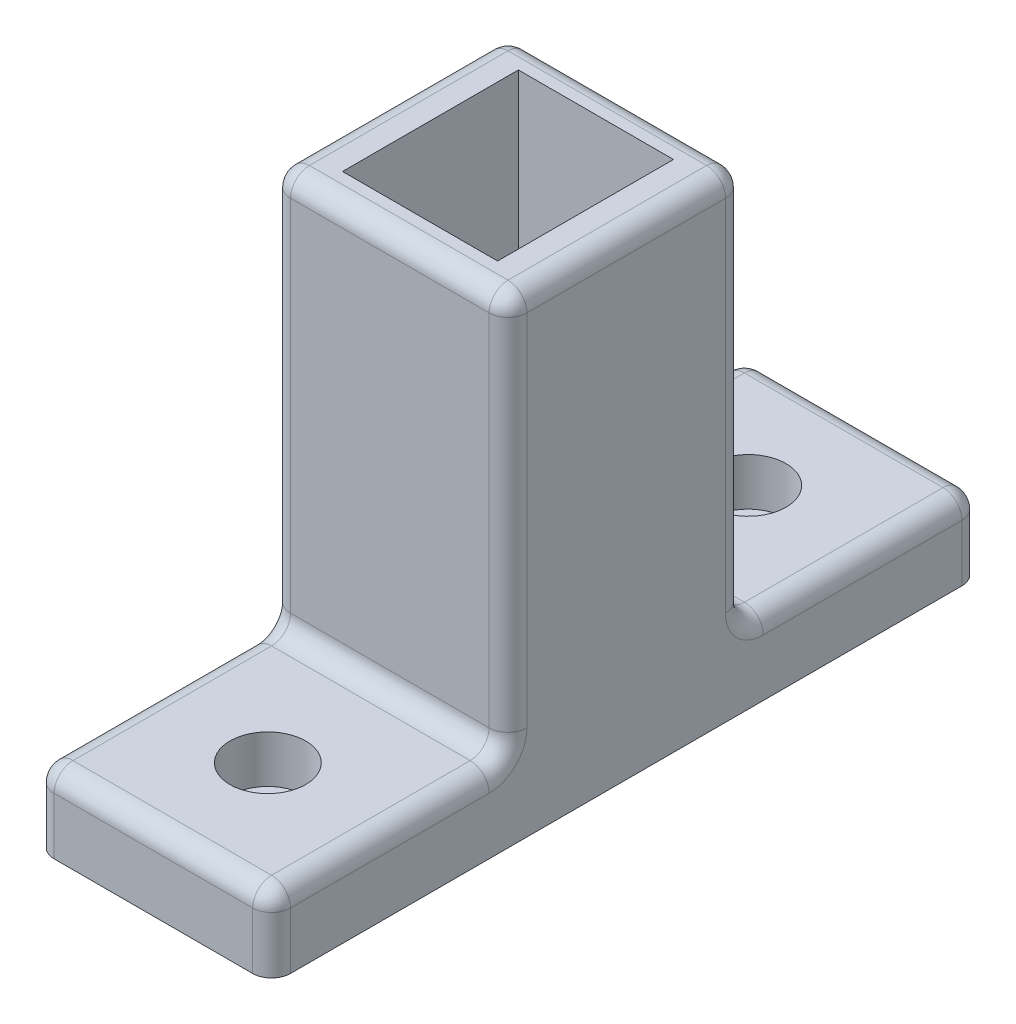
from build123d import *

# Parameters (mm, degrees)
SKETCH1_W               = 25
SKETCH1_H               = 25
SKETCH1_W_2             = 16.4
SKETCH1_H_2             = 18.6
BOSS_EXTRUDE1_DEPTH     = 50
SKETCH6_W               = 25
SKETCH6_H               = 75
BOSS_EXTRUDE3_DEPTH     = 8
FILLET2_R               = 2
SKETCH7_R               = 4
CUT_EXTRUDE1_DEPTH      = 5
CUT_EXTRUDE4_DEPTH      = 64.73774392
CUT_EXTRUDE4_DEPTH_BACK = 64.73774392
SKETCH8_R               = 2.38125


with BuildPart() as part:
    # Sketch1 → Boss-Extrude1 (new body)
    with BuildSketch(Plane(origin=(0, 0, 0), x_dir=(1, 0, 0), z_dir=(0, 1, 0))):
        Rectangle(SKETCH1_W, SKETCH1_H)
        Rectangle(SKETCH1_W_2, SKETCH1_H_2, mode=Mode.SUBTRACT)
    extrude(amount=BOSS_EXTRUDE1_DEPTH)

    # Sketch6 → Boss-Extrude3 (add)
    with BuildSketch(Plane(origin=(0, 0, 0), x_dir=(1, 0, 0), z_dir=(0, 1, 0))):
        Rectangle(SKETCH6_W, SKETCH6_H)
    extrude(amount=BOSS_EXTRUDE3_DEPTH)

    # Fillet2
    fillet2_edges = [part.edges().sort_by_distance(p)[0] for p in [
        (0, 8, -12.5),
        (0, 50, -12.5),
        (12.5, 29, -12.5),
        (12.5, 50, 0),
        (12.5, 29, 12.5),
        (-12.5, 29, 12.5),
        (0, 50, 12.5),
        (-12.5, 29, -12.5),
        (-12.5, 50, 0),
        (-12.5, 8, -25),
        (12.5, 8, -25),
        (0, 8, -37.5),
        (0, 8, 37.5),
        (-12.5, 8, 25),
        (0, 8, 12.5),
        (12.5, 8, 25),
        (12.5, 4, -37.5),
        (-12.5, 4, -37.5),
        (12.5, 4, 37.5),
        (-12.5, 4, 37.5),
    ]]
    fillet(fillet2_edges, radius=FILLET2_R)

    # Sketch7 → Cut-Extrude1 (cut)
    with BuildSketch(Plane(origin=(0, 8, 0), x_dir=(1, 0, 0), z_dir=(0, 1, 0))):
        Circle(SKETCH7_R)
        with Locations((0, 25.4)):
            Circle(SKETCH7_R)
        with Locations((0, -25.4)):
            Circle(SKETCH7_R)
    extrude(amount=-CUT_EXTRUDE1_DEPTH, mode=Mode.SUBTRACT)

    # Sketch8 → Cut-Extrude4 (cut, two sides: drawn at the far end of the back side and taken through both)
    with BuildSketch(Plane(origin=(0, 0, 0), x_dir=(1, 0, 0), z_dir=(0, 1, 0)).offset(-CUT_EXTRUDE4_DEPTH_BACK)):
        Circle(SKETCH8_R)
        with Locations((0, 25.4)):
            Circle(SKETCH8_R)
        with Locations((0, -25.4)):
            Circle(SKETCH8_R)
    extrude(amount=CUT_EXTRUDE4_DEPTH + CUT_EXTRUDE4_DEPTH_BACK, mode=Mode.SUBTRACT)


solid = part.part
